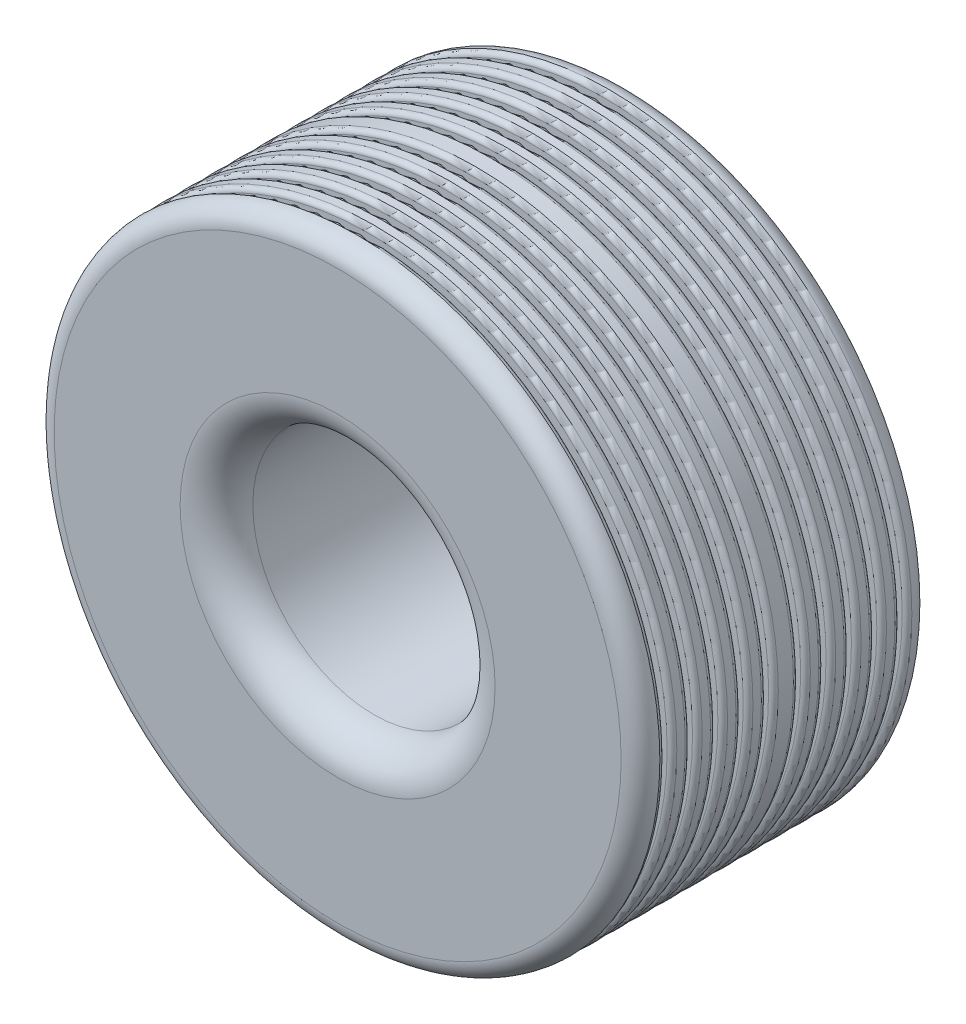
from build123d import *

# Parameters (mm, degrees)
SKETCH1_R           = 125
SKETCH1_R_2         = 50
BOSS_EXTRUDE1_DEPTH = 120
SKETCH5_W           = 3
SKETCH5_H           = 29.132897838
FILLET1_R           = 8
FILLET2_R           = 15
FILLET3_R           = 2


with BuildPart() as part:
    # Sketch1 → Boss-Extrude1 (new body)
    with BuildSketch(Plane.XY):
        Circle(SKETCH1_R)
        Circle(SKETCH1_R_2, mode=Mode.SUBTRACT)
    extrude(amount=BOSS_EXTRUDE1_DEPTH)

    # Sketch5 → Cut-Revolve1 (revolve, cut)
    with BuildSketch(Plane(origin=(0, 0, 0), x_dir=(0, 0, -1), z_dir=(1, 0, 0)), mode=Mode.PRIVATE) as cut_revolve1_sk:
        with Locations((-108.5, 110.433551081)):
            Rectangle(SKETCH5_W, SKETCH5_H)
        with Locations((-98.028564865, 110.433551081)):
            Rectangle(SKETCH5_W, SKETCH5_H)
        with Locations((-87.557129731, 110.433551081)):
            Rectangle(SKETCH5_W, SKETCH5_H)
        with Locations((-77.085694596, 110.433551081)):
            Rectangle(SKETCH5_W, SKETCH5_H)
        with Locations((-66.614259462, 110.433551081)):
            Rectangle(SKETCH5_W, SKETCH5_H)
        with Locations((-53.385740538, 110.433551081)):
            Rectangle(SKETCH5_W, SKETCH5_H)
        with Locations((-42.914305404, 110.433551081)):
            Rectangle(SKETCH5_W, SKETCH5_H)
        with Locations((-32.442870269, 110.433551081)):
            Rectangle(SKETCH5_W, SKETCH5_H)
        with Locations((-21.971435135, 110.433551081)):
            Rectangle(SKETCH5_W, SKETCH5_H)
        with Locations((-11.5, 110.433551081)):
            Rectangle(SKETCH5_W, SKETCH5_H)
    revolve(cut_revolve1_sk.sketch.rotate(Axis((0, 0, 0), (0, 0, -1)), 90), axis=Axis((0, 0, 0), (0, 0, -1)), mode=Mode.SUBTRACT)

    # Fillet1
    fillet1_edges = [part.edges().sort_by_distance(p)[0] for p in [
        (-125, 0, 0),
        (-125, 0, 120),
    ]]
    fillet(fillet1_edges, radius=FILLET1_R)

    # Fillet2
    fillet2_edges = [part.edges().sort_by_distance(p)[0] for p in [
        (-50, 0, 0),
        (-50, 0, 120),
    ]]
    fillet(fillet2_edges, radius=FILLET2_R)

    # Fillet3
    fillet3_edges = [part.edges().sort_by_distance(p)[0] for p in [
        (-125, 0, 110),
        (-125, 0, 107),
        (-125, 0, 96.528564865),
        (-125, 0, 99.528564865),
        (-125, 0, 86.057129731),
        (-125, 0, 89.057129731),
        (-125, 0, 75.585694596),
        (-125, 0, 78.585694596),
        (-125, 0, 65.114259462),
        (-125, 0, 68.114259462),
        (-125, 0, 54.885740538),
        (-125, 0, 51.885740538),
        (-125, 0, 44.414305404),
        (-125, 0, 41.414305404),
        (-125, 0, 33.942870269),
        (-125, 0, 30.942870269),
        (-125, 0, 23.471435135),
        (-125, 0, 20.471435135),
        (-125, 0, 10),
        (-125, 0, 13),
    ]]
    fillet(fillet3_edges, radius=FILLET3_R - 0.0001)  # a hair under: the kernel refuses the full size


solid = part.part
